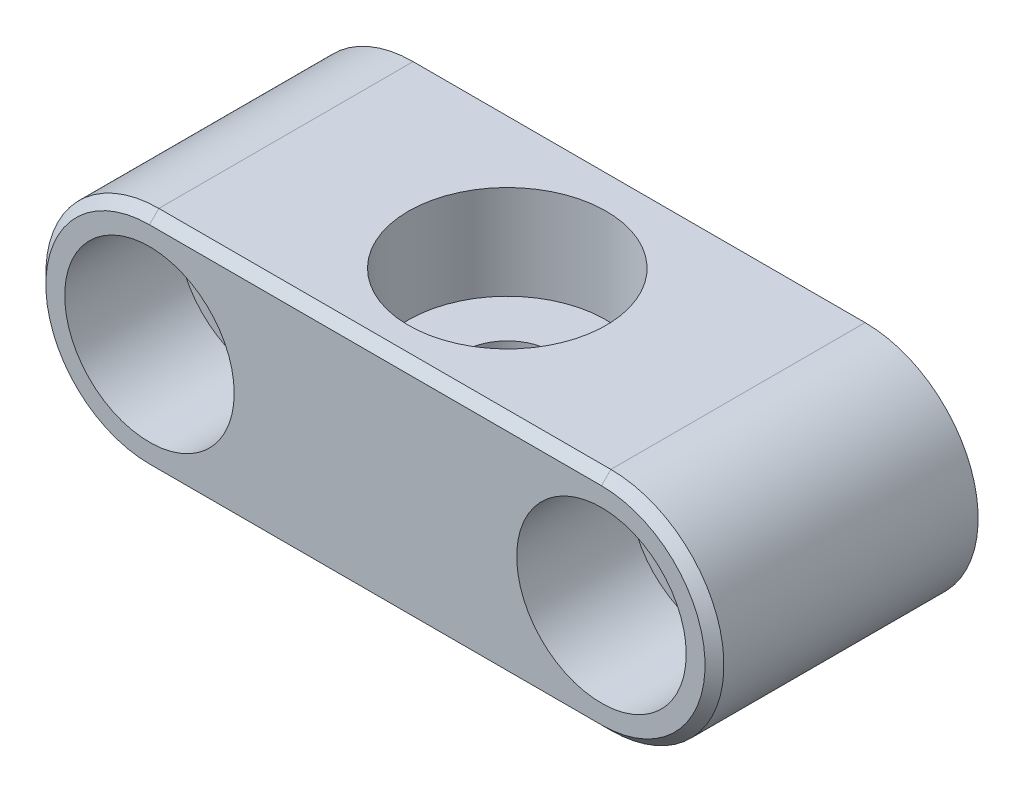
from build123d import *

# Parameters (mm, degrees)
SKETCH1_R           = 2.75
BOSS_EXTRUDE1_DEPTH = 7
SKETCH2_R           = 2.35
CUT_EXTRUDE1_DEPTH  = 23.737634002
SKETCH3_R           = 5.25
CUT_EXTRUDE2_DEPTH  = 5
CHAMFER1_SIZE       = 0.5
SKETCH4_R           = 4.5
CUT_EXTRUDE3_DEPTH  = 6


with BuildPart() as part:
    # Sketch1 → Boss-Extrude1 (new, symmetric)
    with BuildSketch(Plane.XY):
        with BuildLine():
            Line((12, -6), (-12, -6))
            ThreePointArc((-12, -6), (-18, 0), (-12, 6))
            Line((-12, 6), (12, 6))
            ThreePointArc((12, 6), (18, 0), (12, -6))
        make_face()
        with Locations((-12, 0)):
            Circle(SKETCH1_R, mode=Mode.SUBTRACT)
        with Locations((12, 0)):
            Circle(SKETCH1_R, mode=Mode.SUBTRACT)
    extrude(amount=BOSS_EXTRUDE1_DEPTH, both=True)

    # Sketch2 → Cut-Extrude1 (cut, through all)
    with BuildSketch(Plane(origin=(0, 6, 0), x_dir=(1, 0, 0), z_dir=(0, 1, 0))):
        Circle(SKETCH2_R)
    extrude(amount=-CUT_EXTRUDE1_DEPTH, mode=Mode.SUBTRACT)

    # Sketch3 → Cut-Extrude2 (cut)
    with BuildSketch(Plane(origin=(0, 6, 0), x_dir=(1, 0, 0), z_dir=(0, 1, 0))):
        Circle(SKETCH3_R)
    extrude(amount=-CUT_EXTRUDE2_DEPTH, mode=Mode.SUBTRACT)

    # Chamfer1
    chamfer1_edges = [part.edges().sort_by_distance(p)[0] for p in [
        (0, -6, 7),
        (18, 0, 7),
        (-18, 0, 7),
        (0, 6, 7),
    ]]
    chamfer(chamfer1_edges, length=CHAMFER1_SIZE)

    # Sketch4 → Cut-Extrude3 (cut)
    with BuildSketch(Plane.XY.offset(7)):
        with Locations((-12, 0)):
            Circle(SKETCH4_R)
        with Locations((12, 0)):
            Circle(SKETCH4_R)
    extrude(amount=-CUT_EXTRUDE3_DEPTH, mode=Mode.SUBTRACT)


solid = part.part
